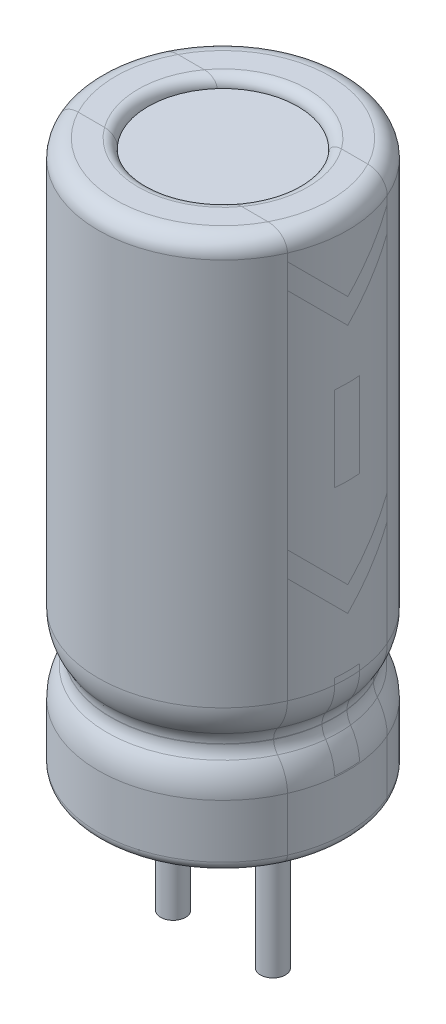
from build123d import *

# Parameters (mm, degrees)
FILLET_12_R         = 0.4
FILLET_13_R         = 1
FILLET_14_R         = 1
SKETCH_3_R          = 1.75
CUT_EXTRUDE_1_DEPTH = 0.8
FILLET_15_R         = 0.2
FILLET_16_R         = 0.1
EXTRUDE_START       = 0.7
SKETCH_4_R          = 1.75
EXTRUDE_3_DEPTH     = 0.7
SKETCH_5_R          = 0.25
EXTRUDE_4_DEPTH     = 3
SKETCH_6_R          = 1.5
CUT_EXTRUDE_2_DEPTH = 0.3
SKETCH_7_R          = 1.75
EXTRUDE_5_DEPTH     = 0.1
FILLET_17_R         = 0.2
FILLET_18_R         = 0.35


# Some blends are built 0.0001 mm under size
with BuildPart() as part:
    # Эскиз1 → Повернуть2 (revolve)
    with BuildSketch(Plane.XY, mode=Mode.PRIVATE) as revolve_2_sk:
        Polygon((0, 0), (-2.5, 0), (-2.5, 1.7), (-2.25, 1.7), (-2.25, 2.45), (-2.5, 2.45), (-2.5, 11), (0, 11), align=None)
    revolve(revolve_2_sk.sketch.rotate(Axis((0, 39.066160875, 0), (0, -1, 0)), 270), axis=Axis((0, 39.066160875, 0), (0, -1, 0)))

    # Скругление12
    # the kernel refuses this fillet: 0.4 mm, written as the material it adds along each edge
    with BuildSketch(Plane(origin=(0, 2.45, 0), x_dir=(0, 0, 1), z_dir=(1, 0, 0))) as fillet_12_piece_1:
        with BuildLine():
            CenterArc((2.65, 0.370809924), FILLET_12_R, 180, 67.975687163)
            Line((2.5, 0), (2.497, -0.007416198))
            ThreePointArc((2.497, -0.007416198), (2.375, -0.008), (2.25, -0.008))
            Line((2.25, -0.008), (2.242, 0))
            Line((2.242, 0), (2.242, 0.370809924))
            Line((2.242, 0.370809924), (2.25, 0.370809924))
        make_face()
    revolve(axis=Axis((0, 2.45, 0), (0, -1, 0)))
    with BuildSketch(Plane(origin=(0, 1.7, 0), x_dir=(0, 0, 1), z_dir=(1, 0, 0))) as fillet_12_piece_2:
        with BuildLine():
            CenterArc((2.65, -0.370809924), FILLET_12_R, 112.024312837, 67.975687163)
            Line((2.25, -0.370809924), (2.242, -0.370809924))
            Line((2.242, -0.370809924), (2.242, 0))
            Line((2.242, 0), (2.25, 0.008))
            ThreePointArc((2.25, 0.008), (2.375, 0.008), (2.497, 0.007416198))
            Line((2.497, 0.007416198), (2.5, 0))
        make_face()
    revolve(axis=Axis((0, 1.7, 0), (0, -1, 0)))

    # Скругление13
    fillet_13_edges = [part.edges().sort_by_distance(p)[0] for p in [
        (0, 2.45, -2.5),
    ]]
    fillet(fillet_13_edges, radius=FILLET_13_R)

    # Скругление14
    fillet_14_edges = [part.edges().sort_by_distance(p)[0] for p in [
        (0, 1.7, -2.5),
    ]]
    fillet(fillet_14_edges, radius=FILLET_14_R)

    # Эскиз3 → Вырез-Вытянуть1 (cut)
    with BuildSketch(Plane.XZ):
        with Locations(Location((0, 0, 0), (0, 0, 270))):
            Circle(SKETCH_3_R)
    extrude(amount=-CUT_EXTRUDE_1_DEPTH, mode=Mode.SUBTRACT)

    # Скругление15
    fillet_15_edges = [part.edges().sort_by_distance(p)[0] for p in [
        (0, 0, -2.5),
    ]]
    fillet(fillet_15_edges, radius=FILLET_15_R)

    # Скругление16
    fillet_16_edges = [part.edges().sort_by_distance(p)[0] for p in [
        (0, 0, 1.75),
    ]]
    fillet(fillet_16_edges, radius=FILLET_16_R)

    # Эскиз4 → Бобышка-Вытянуть3 (add)
    with BuildSketch(Plane.XZ.offset(-0.8).offset(EXTRUDE_START)):
        Circle(SKETCH_4_R)
    extrude(amount=-EXTRUDE_3_DEPTH)

    # Эскиз5 → Бобышка-Вытянуть4 (add)
    with BuildSketch(Plane.XZ.offset(-0.1)):
        with Locations(Location((-1, 0, 0), (0, 0, 270))):
            Circle(SKETCH_5_R)
        with Locations(Location((1, 0, 0), (0, 0, 90))):
            Circle(SKETCH_5_R)
    extrude(amount=EXTRUDE_4_DEPTH)

    # Эскиз6 → Вырез-Вытянуть2 (cut)
    with BuildSketch(Plane(origin=(0, 11, 0), x_dir=(1, 0, 0), z_dir=(0, 1, 0))):
        with Locations(Location((0, 0, 0), (0, 0, 270))):
            Circle(SKETCH_6_R)
    extrude(amount=-CUT_EXTRUDE_2_DEPTH, mode=Mode.SUBTRACT)

    # Эскиз7 → Бобышка-Вытянуть5 (add)
    with BuildSketch(Plane(origin=(0, 10.7, 0), x_dir=(1, 0, 0), z_dir=(0, 1, 0))):
        Circle(SKETCH_7_R)
    extrude(amount=EXTRUDE_5_DEPTH)

    # Скругление17
    fillet_17_edges = [part.edges().sort_by_distance(p)[0] for p in [
        (0, 11, -1.5),
    ]]
    fillet(fillet_17_edges, radius=FILLET_17_R - 0.0001)  # a hair under: the kernel refuses the full size

    # Скругление18
    fillet_18_edges = [part.edges().sort_by_distance(p)[0] for p in [
        (0, 11, -2.5),
    ]]
    fillet(fillet_18_edges, radius=FILLET_18_R)


solid = part.part
